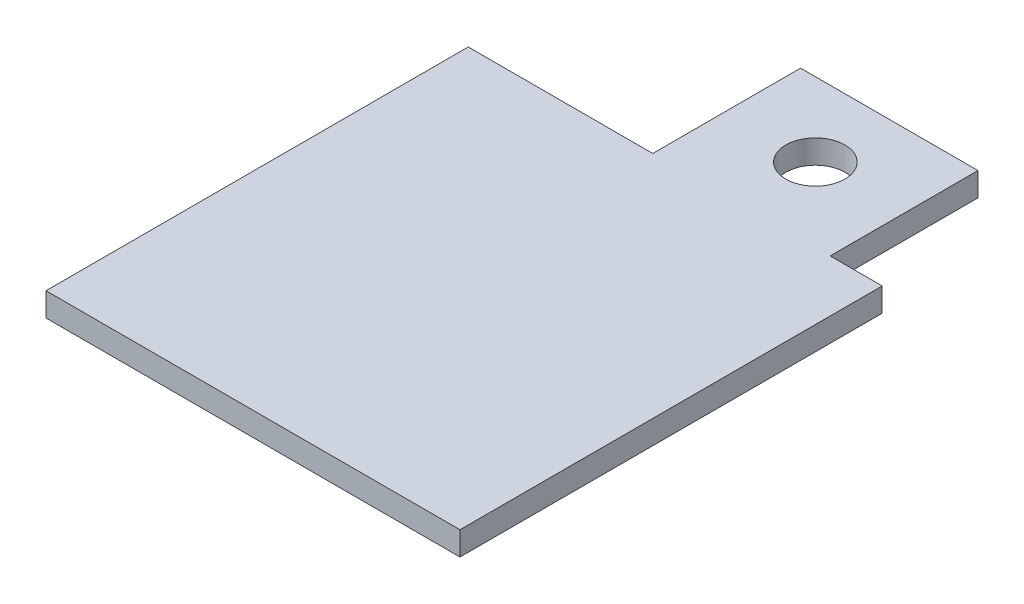
from build123d import *

# Parameters (mm, degrees)
SKETCH1_R           = 2.5
BOSS_EXTRUDE1_DEPTH = 2


with BuildPart() as part:
    # Sketch1 → Boss-Extrude1 (new body)
    with BuildSketch(Plane(origin=(0, 0, 0), x_dir=(1, 0, 0), z_dir=(0, 1, 0))):
        Polygon((-17.5, 17.5), (-17.5, -18.2), (17.5, -18.2), (17.5, 17.5), (13.1, 17.5), (13.1, 30), (-1.9, 30), (-1.9, 17.5), align=None)
        with Locations((5.6, 23.75)):
            Circle(SKETCH1_R, mode=Mode.SUBTRACT)
    extrude(amount=BOSS_EXTRUDE1_DEPTH)


solid = part.part
